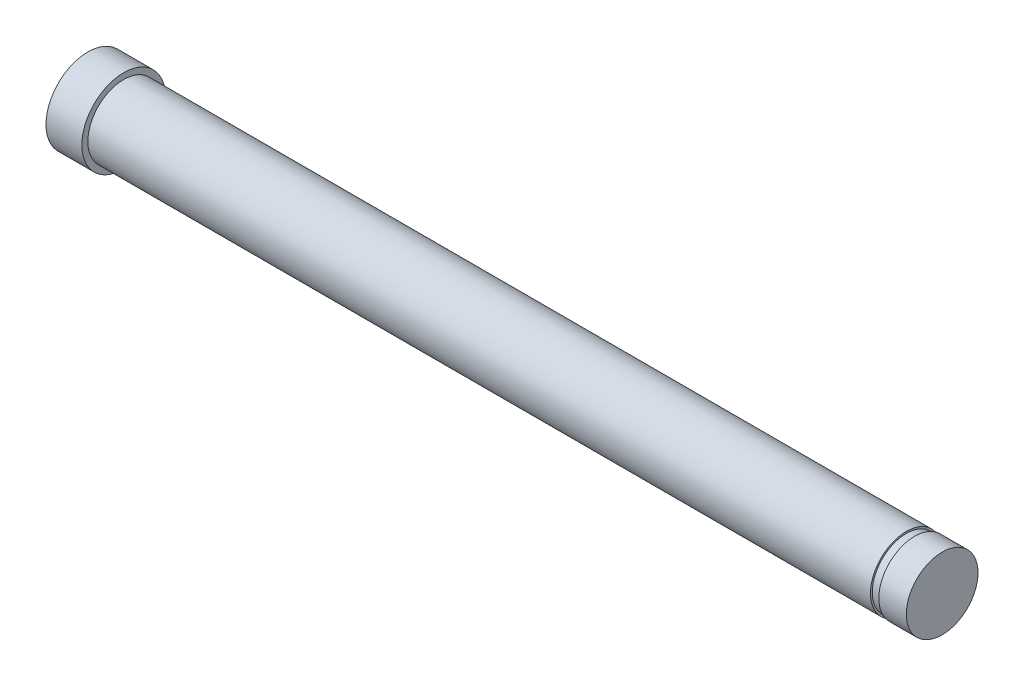
from build123d import *
from build123d.topology import SkipClean

# Parameters (mm, degrees)
SKETCH_2_R          = 3
EXTRUDE_1_DEPTH     = 4
EXTRUDE_2_DEPTH     = 2.5
SKETCH_5_R          = 2.5
EXTRUDE_3_DEPTH     = 9
MIRROR_START        = 15.5
MIRROR_1_DEPTH      = 0.381197772
MIRROR_START_2      = 15.881197772
MIRROR_1_2_DEPTH    = 4.618802228
EXTRUDE_4_DEPTH     = 5
SKETCH_10_R         = 2.5
EXTRUDE_5_DEPTH     = 6
SKETCH_11_R         = 3
EXTRUDE_6_DEPTH     = 5.5
EXTRUDE_START       = 10
SKETCH_12_R         = 3
EXTRUDE_8_DEPTH     = 10
SKETCH_13_R         = 3
EXTRUDE_9_DEPTH     = 10
SKETCH_14_OUTSIDE_W = 32.048
SKETCH_14_OUTSIDE_H = 35.048
SKETCH_14_OUTSIDE_R = 3
CUT_EXTRUDE_2_DEPTH = 59.352377883
SKETCH_15_R         = 3
EXTRUDE_10_DEPTH    = 29.5
EXTRUDE_11_DEPTH    = 26.5
SKETCH_18_R         = 3.5
EXTRUDE_12_DEPTH    = 3
CUT_EXTRUDE_START   = -3
SKETCH_19_R         = 3
SKETCH_19_R_2       = 2.85
CUT_EXTRUDE_3_DEPTH = 0.7


with BuildPart() as part:
    # 草图2 → 凸台-拉伸1 (new, symmetric)
    with BuildSketch(Plane(origin=(0, 0, 0), x_dir=(0, 0, -1), z_dir=(1, 0, 0))):
        Circle(SKETCH_2_R)
    extrude_1 = extrude(amount=EXTRUDE_1_DEPTH, both=True)

    # 草图3 → 凸台-拉伸2 (add, symmetric)
    with BuildSketch(Plane(origin=(4, 0, 0), x_dir=(0, 0, -1), z_dir=(1, 0, 0))):
        with BuildLine():
            Line((5, 0), (5, -8))
            ThreePointArc((5, -8), (0, -13), (-5, -8))
            Line((-5, -8), (-5, 0))
            ThreePointArc((-5, 0), (0, 5), (5, 0))
        make_face()
    extrude(amount=EXTRUDE_2_DEPTH, both=True)

    # 切除-旋转1: read off the stored shape, not the designer's step
    # 切除-旋转1 outline → 切除-旋转1 (revolve, cut)
    with BuildSketch(Plane.YX):
        Polygon((13.0002322, 6.118936215), (4.99999958, 1.499999757), (13.0002322, 1.499999757), align=None)
    revolve(axis=Axis((0, 0, 0), (1, 0, 0)), mode=Mode.SUBTRACT)

    # 草图5 → 凸台-拉伸3 (add)
    with BuildSketch(Plane(origin=(6.5, 0, 0), x_dir=(0, 0, -1), z_dir=(1, 0, 0))):
        with Locations((0, -8)):
            Circle(SKETCH_5_R)
    extrude(amount=EXTRUDE_3_DEPTH)

    # 镜向1: read off the stored shape, not the designer's step
    # 镜向1 outline → 镜向1 (add)
    with BuildSketch(Plane.YZ.offset(MIRROR_START)):
        with BuildLine():
            Line((-8, -5), (0, -5))
            ThreePointArc((0, -5), (5, 0), (0, 5))
            Line((0, 5), (-7.999999997, 5))
            ThreePointArc((-7.999999997, 5), (-13, 2e-09), (-8, -5))
        make_face()
    extrude(amount=MIRROR_1_DEPTH)

    # Mirror 1 2 outline → Mirror 1 2 (add)
    with BuildSketch(Plane.YZ.offset(MIRROR_START_2)):
        with BuildLine():
            Line((-8, -5), (0, -5))
            ThreePointArc((0, -5), (5, 0), (0, 5))
            Line((0, 5), (-7.999999997, 5))
            ThreePointArc((-7.999999997, 5), (-13, 2e-09), (-8, -5))
        make_face()
    extrude(amount=MIRROR_1_2_DEPTH)

    # Mirror 1 3 outline → Mirror 1 3 (revolve, cut)
    with BuildSketch(Plane.YX):
        Polygon((13.0002322, 20.500000243), (4.99999958, 20.500000243), (13.0002322, 15.881063785), align=None)
    revolve(axis=Axis((0, 0, 0), (1, 0, 0)), mode=Mode.SUBTRACT)

    # 镜向2: 凸台-拉伸1 across plane
    add(extrude_1.mirror(Plane(origin=(11, 0, 0), x_dir=(0, 0, 1), z_dir=(1, 0, 0))))

    # 草图6 → 凸台-拉伸4 (add)
    with BuildSketch(Plane(origin=(26, 0, 0), x_dir=(0, 0, -1), z_dir=(1, 0, 0))):
        with BuildLine():
            Line((0, -5), (-5, -5))
            ThreePointArc((-5, -5), (-10, 0), (-5, 5))
            Line((-5, 5), (0, 5))
            ThreePointArc((0, 5), (5, 0), (0, -5))
        make_face()
    extrude_4 = extrude(amount=EXTRUDE_4_DEPTH)

    # 切除-旋转2: read off the stored shape, not the designer's step
    # 切除-旋转2 outline → 切除-旋转2 (revolve, cut)
    with BuildSketch(Plane.YX):
        Polygon((10.000264544, 30.195720135), (5, 26), (10.000264544, 26), align=None)
    cut_revolve_2 = revolve(axis=Axis((0, 0, 0), (1, 0, 0)), mode=Mode.SUBTRACT)

    # 草图10 → 凸台-拉伸5 (add)
    with BuildSketch(Plane(origin=(31, 0, 0), x_dir=(0, 0, -1), z_dir=(1, 0, 0))):
        with Locations((-5, 0)):
            Circle(SKETCH_10_R)
    extrude(amount=EXTRUDE_5_DEPTH)

    # 镜向3: 凸台-拉伸4, 切除-旋转2 across plane
    add(extrude_4.mirror(Plane(origin=(34, 0, 0), x_dir=(0, 0, 1), z_dir=(1, 0, 0))))
    add(cut_revolve_2.mirror(Plane(origin=(34, 0, 0), x_dir=(0, 0, 1), z_dir=(1, 0, 0))), mode=Mode.SUBTRACT)

    # 草图11 → 凸台-拉伸6 (add)
    with BuildSketch(Plane(origin=(42, 0, 0), x_dir=(0, 0, -1), z_dir=(1, 0, 0))):
        Circle(SKETCH_11_R)
    extrude(amount=EXTRUDE_6_DEPTH)

    # 草图12 → 凸台-拉伸8 (add)
    with BuildSketch(Plane.ZY.offset(4).offset(EXTRUDE_START)):
        Circle(SKETCH_12_R)
    extrude(amount=-EXTRUDE_8_DEPTH)

    # 草图13 → 凸台-拉伸9 (add)
    with BuildSketch(Plane(origin=(47.5, 0, 0), x_dir=(0, 0, -1), z_dir=(1, 0, 0))):
        with Locations(Location((0, 0, 0), (0, 0, 180))):
            Circle(SKETCH_13_R)
    extrude(amount=EXTRUDE_9_DEPTH)

    # 草图14 outside → 切除-拉伸2 (cut, through all)
    with SkipClean():  # the faces are left unmerged after this step: merging them gives an invalid solid
        with BuildSketch(Plane.ZY.offset(-1.5)):
            with Locations((2.5, -4)):
                Rectangle(SKETCH_14_OUTSIDE_W, SKETCH_14_OUTSIDE_H)
            Circle(SKETCH_14_OUTSIDE_R, mode=Mode.SUBTRACT)
        extrude(amount=-CUT_EXTRUDE_2_DEPTH, mode=Mode.SUBTRACT)


with BuildPart() as cut_extrude_2_piece_1:
    # of the separate pieces the step leaves, piece 1, a body of its own (cut_extrude_2_pieces)
    add(part.part.solids().sort_by_distance((37, -1.139901312, 2.775))[0])



with BuildPart() as cut_extrude_2_piece_2:
    # of the separate pieces the step leaves, piece 2, a body of its own (cut_extrude_2_pieces)
    add(part.part.solids().sort_by_distance((6.5, 0, 3))[0])


with BuildPart() as cut_extrude_2_piece_1_1:
    with SkipClean():  # the faces are left unmerged after this step: merging them gives an invalid solid
        add(cut_extrude_2_piece_1.part)

        add(cut_extrude_2_piece_2.part)  # 凸台-拉伸10 merges 切除-拉伸2 piece 2
        # 草图15 → 凸台-拉伸10 (add)
        with BuildSketch(Plane.ZY.offset(-15.5)):
            Circle(SKETCH_15_R)
        extrude(amount=EXTRUDE_10_DEPTH)

    # 草图16 → 凸台-拉伸11 (add)
    with BuildSketch(Plane(origin=(31, 0, 0), x_dir=(0, 0, -1), z_dir=(1, 0, 0))):
        with BuildLine():
            ThreePointArc((-2.775, -1.139901312), (-2.5, 0), (-2.775, 1.139901312))
            ThreePointArc((-2.775, 1.139901312), (3, 0), (-2.775, -1.139901312))
        make_face()
    extrude(amount=EXTRUDE_11_DEPTH)

    # 草图18 → 凸台-拉伸12 (add)
    with BuildSketch(Plane.ZY.offset(14)):
        Circle(SKETCH_18_R)
    extrude(amount=-EXTRUDE_12_DEPTH)

    # 草图19 → 切除-拉伸3 (cut)
    with BuildSketch(Plane(origin=(57.5, 0, 0), x_dir=(0, 0, -1), z_dir=(1, 0, 0)).offset(CUT_EXTRUDE_START)):
        with Locations(Location((0, 0, 0), (0, 0, 180))):
            Circle(SKETCH_19_R)
        Circle(SKETCH_19_R_2, mode=Mode.SUBTRACT)
    extrude(amount=CUT_EXTRUDE_3_DEPTH, mode=Mode.SUBTRACT)


solid = cut_extrude_2_piece_1_1.part
